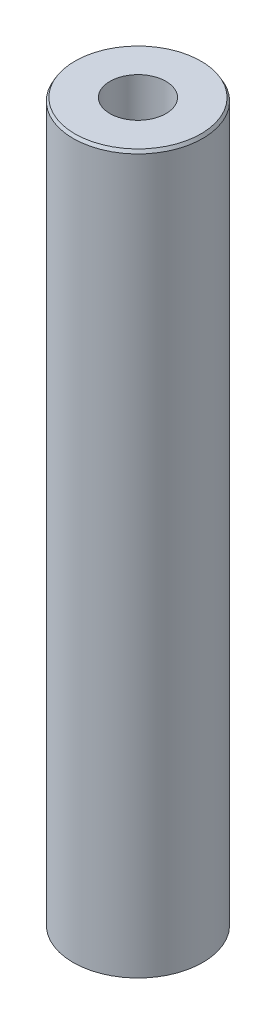
from build123d import *
from OCP.BRepFilletAPI import BRepFilletAPI_MakeChamfer

# Parameters (mm, degrees)
SKETCH1_R           = 50
BOSS_EXTRUDE1_DEPTH = 554.214912451
SKETCH2_R           = 21.604074961
CUT_EXTRUDE1_DEPTH  = 559.707588263
CHAMFER1_SIZE       = 2.387065629
CHAMFER1_SIZE2      = 1.378172983


with BuildPart() as part:
    # Sketch1 → Boss-Extrude1 (new body)
    with BuildSketch(Plane(origin=(0, 0, 0), x_dir=(1, 0, 0), z_dir=(0, 1, 0))):
        Circle(SKETCH1_R)
    extrude(amount=BOSS_EXTRUDE1_DEPTH)

    # Sketch2 → Cut-Extrude1 (cut, through all)
    with BuildSketch(Plane(origin=(0, 0, 0), x_dir=(1, 0, 0), z_dir=(0, 1, 0))):
        Circle(SKETCH2_R)
    extrude(amount=CUT_EXTRUDE1_DEPTH, mode=Mode.SUBTRACT)

    # Chamfer1: one chamfer whose edges measure the first distance from different faces: ONE call of the kernel's chamfer builder (chamfer() names one face for all edges)
    chamfer1_edges_1 = [part.edges().sort_by_distance(p)[0] for p in [
        (-50, 554.214912451, 0),
    ]]
    chamfer1_side_1 = [part.faces().sort_by_distance(p)[0] for p in [
        (-50, 277.107456225, 0),
    ]]
    chamfer1_edges_2 = [part.edges().sort_by_distance(p)[0] for p in [
        (-50, 0, 0),
    ]]
    chamfer1_side_2 = [part.faces().sort_by_distance(p)[0] for p in [
        (-48.585786438, 0, 0),
    ]]
    chamfer1 = BRepFilletAPI_MakeChamfer(part.part.solid().wrapped)
    for e in chamfer1_edges_1:
        chamfer1.Add(CHAMFER1_SIZE, CHAMFER1_SIZE2, e.wrapped, chamfer1_side_1[0].wrapped)  # the first distance lies on this face
    for e in chamfer1_edges_2:
        chamfer1.Add(CHAMFER1_SIZE, CHAMFER1_SIZE2, e.wrapped, chamfer1_side_2[0].wrapped)  # the first distance lies on this face
    add(Compound.cast(chamfer1.Shape()), mode=Mode.REPLACE)


solid = part.part
